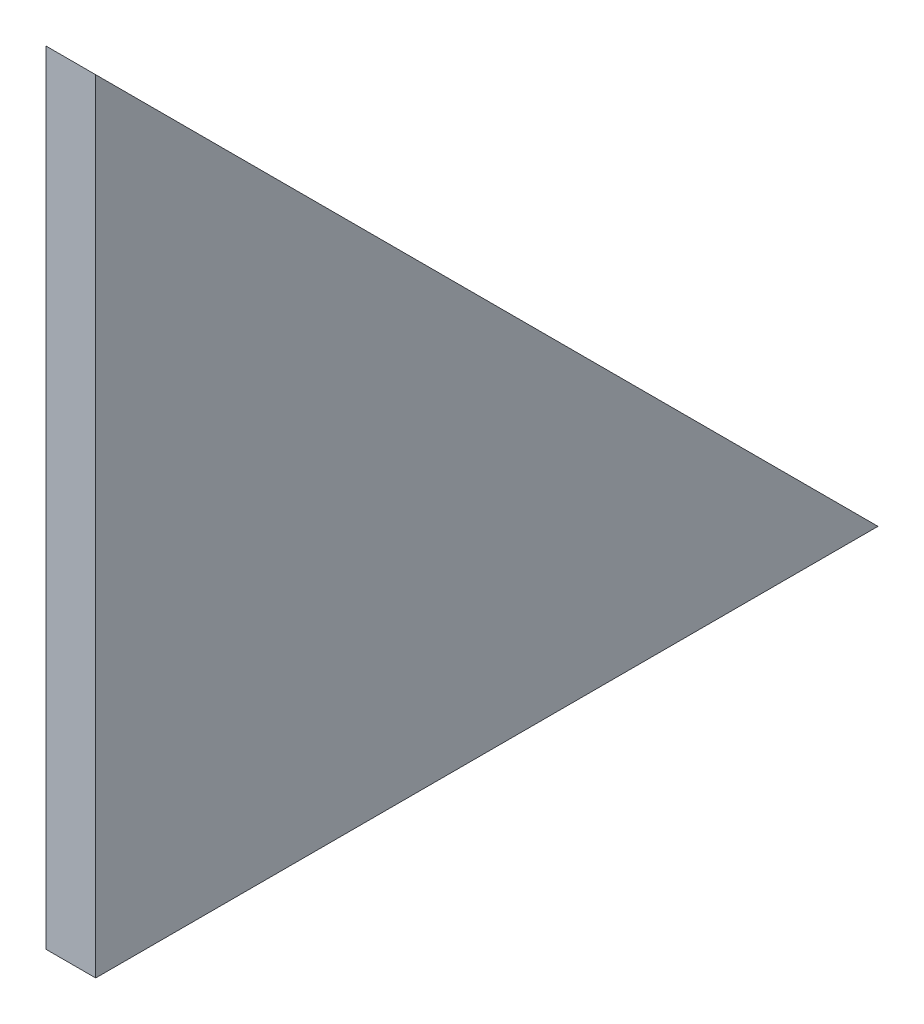
from build123d import *

# Parameters (mm, degrees)
CROQUIS1_W              = 6.35
CROQUIS1_H              = 100
SALIENTE_EXTRUIR1_DEPTH = 50
CORTAR_EXTRUIR1_DEPTH   = 100


with BuildPart() as part:
    # Croquis1 → Saliente-Extruir1 (new, symmetric)
    with BuildSketch(Plane.XY):
        Rectangle(CROQUIS1_W, CROQUIS1_H)
    extrude(amount=SALIENTE_EXTRUIR1_DEPTH, both=True)

    # Croquis2 → Cortar-Extruir1 (cut)
    with BuildSketch(Plane(origin=(3.175, 0, 0), x_dir=(0, 0, -1), z_dir=(1, 0, 0))):
        Polygon((50, 50), (-50, 50), (50, -50), align=None)
    extrude(amount=-CORTAR_EXTRUIR1_DEPTH, mode=Mode.SUBTRACT)


solid = part.part
